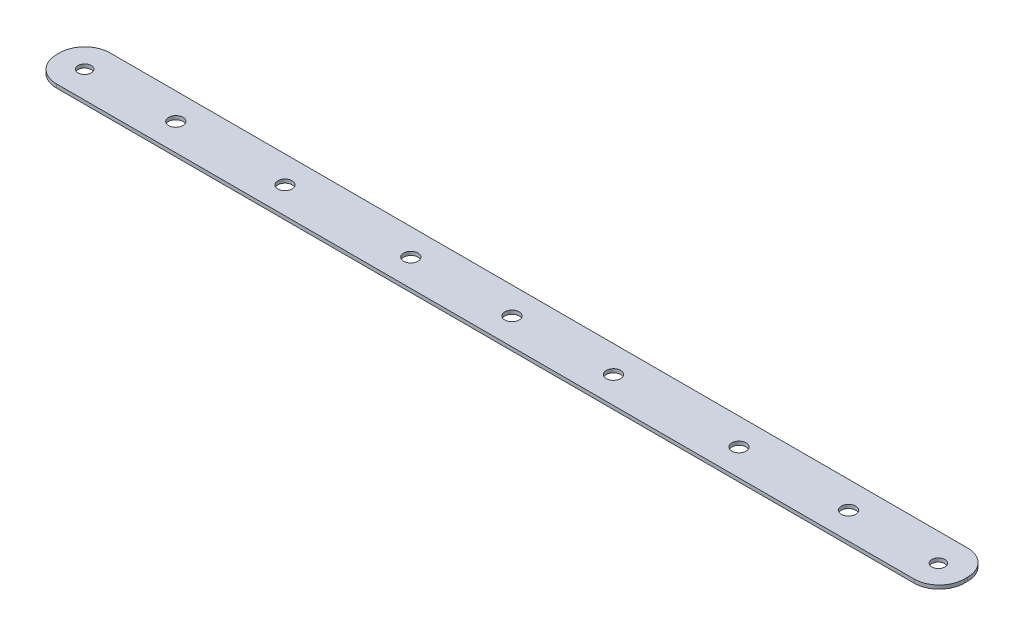
from build123d import *

# Parameters (mm, degrees)
SKETCH1_W                = 215.9
SKETCH1_H                = 12.75
SKETCH1_R                = 1.55
BASE_FLANGE1_DEPTH       = 0.86
FILLET1_R                = 6
M3_CLEARANCE_HOLE1_D     = 3.4
M3_CLEARANCE_HOLE1_DEPTH = 1.29
M3_CLEARANCE_HOLE1_TIP   = 1.021463052
M3_CLEARANCE_HOLE2_D     = 3.4
M3_CLEARANCE_HOLE2_DEPTH = 1.29
M3_CLEARANCE_HOLE2_TIP   = 1.021463052
SKETCH14_R               = 1.55
CUT_EXTRUDE1_DEPTH       = 82


# Sheet-metal steps are written as plain solids
with BuildPart() as part:
    # Sketch1 → Base-Flange1 (new body)
    with BuildSketch(Plane(origin=(0, 0, 0), x_dir=(1, 0, 0), z_dir=(0, 1, 0))):
        Rectangle(SKETCH1_W, SKETCH1_H)
        with Locations(Location((-101.6, 0, 0), (0, 0, 270))):
            Circle(SKETCH1_R, mode=Mode.SUBTRACT)
    extrude(amount=-BASE_FLANGE1_DEPTH)

    # Fillet1
    fillet1_edges = [part.edges().sort_by_distance(p)[0] for p in [
        (-107.95, -0.43, -6.375),
        (107.95, -0.43, -6.375),
        (107.95, -0.43, 6.375),
        (-107.95, -0.43, 6.375),
    ]]
    fillet(fillet1_edges, radius=FILLET1_R)

    # M3 Clearance Hole1
    with Locations(Plane(origin=(0, 0, 0), x_dir=(1, 0, 0), z_dir=(0, 1, 0))):
        with Locations((-80.011608413, 0.075207541), (-24.131608413, 0.075207541), (80.01, 0), (24.13, 0)):
            Hole(M3_CLEARANCE_HOLE1_D / 2, depth=M3_CLEARANCE_HOLE1_DEPTH)
            with Locations((0, 0, -(M3_CLEARANCE_HOLE1_DEPTH + M3_CLEARANCE_HOLE1_TIP / 2))):  # 118° drill point
                Cone(0, M3_CLEARANCE_HOLE1_D / 2, M3_CLEARANCE_HOLE1_TIP, mode=Mode.SUBTRACT)

    # M3 Clearance Hole2
    with Locations(Plane(origin=(0, 0, 0), x_dir=(1, 0, 0), z_dir=(0, 1, 0))):
        with Locations((0, 0), (-53.975, 0), (53.975, 0)):
            Hole(M3_CLEARANCE_HOLE2_D / 2, depth=M3_CLEARANCE_HOLE2_DEPTH)
            with Locations((0, 0, -(M3_CLEARANCE_HOLE2_DEPTH + M3_CLEARANCE_HOLE2_TIP / 2))):  # 118° drill point
                Cone(0, M3_CLEARANCE_HOLE2_D / 2, M3_CLEARANCE_HOLE2_TIP, mode=Mode.SUBTRACT)

    # Sketch14 → Cut-Extrude1 (cut)
    with BuildSketch(Plane(origin=(0, 0, 0), x_dir=(1, 0, 0), z_dir=(0, 1, 0))):
        with Locations(Location((101.601385273, -0.242368773, 0), (0, 0, 270))):
            Circle(SKETCH14_R)
    extrude(amount=-CUT_EXTRUDE1_DEPTH, mode=Mode.SUBTRACT)


solid = part.part
